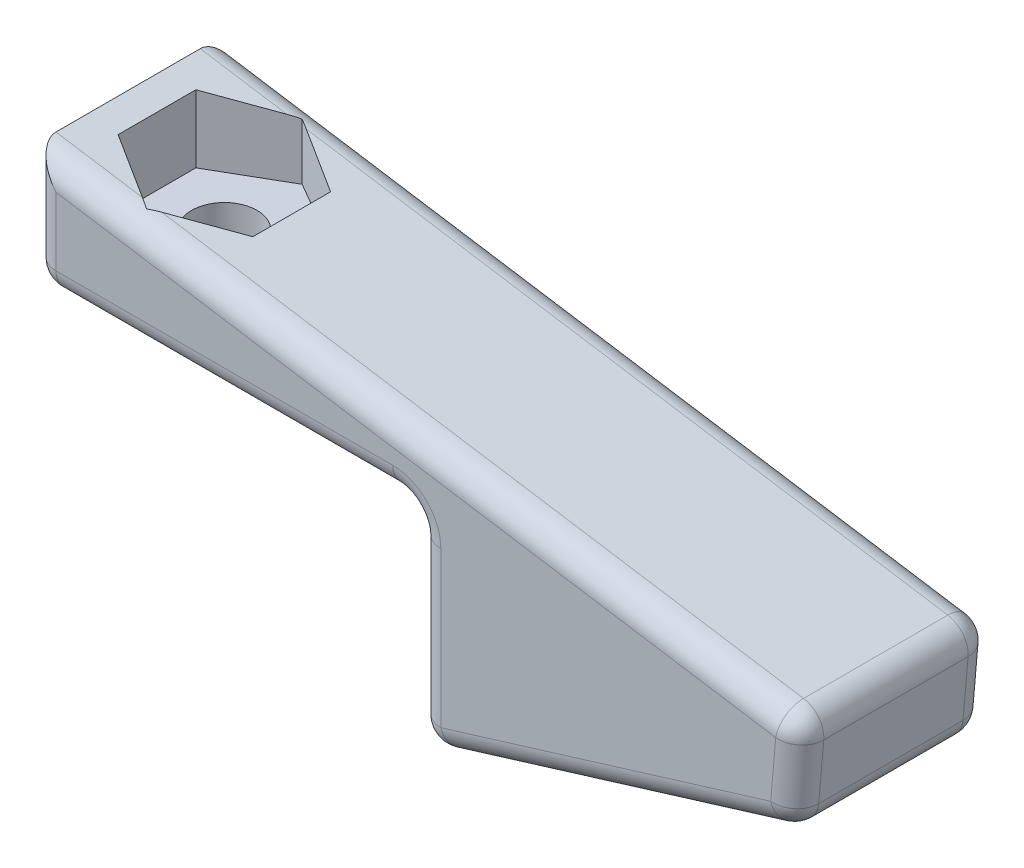
from build123d import *

# Parameters (mm, degrees)
BOSS_EXTRUDE1_DEPTH = 6.35
CUT_EXTRUDE1_REACH  = 55.067
SKETCH2_R           = 2.159
CUT_EXTRUDE2_REACH  = 58.242
CUT_EXTRUDE2_START  = -3.175
SKETCH4_R           = 1.905
CUT_EXTRUDE3_DEPTH  = 19.05
FILLET1_R           = 1.5875


with BuildPart() as part:
    # Sketch1 → Boss-Extrude1 (new, symmetric)
    with BuildSketch(Plane.XY):
        Polygon((0, 0), (0, 7.9375), (25.4, 3.96875), (50.8, 0), (50.244446987, -6.35), (25.4, -13.97), (25.4, 0), align=None)
    extrude(amount=BOSS_EXTRUDE1_DEPTH, both=True)

    # Cut-Extrude1: up to this plane
    cut_extrude1_end = Plane(origin=(0, 7.9375, 6.35), z_dir=(-0.15437688027360963, -0.9880120337511015, 0))
    # Sketch2 → Cut-Extrude1 (cut, up to the surface)
    with BuildSketch(Plane(origin=(0, 0, 0), x_dir=(-1, 0, 0), z_dir=(0, -1, 0)), mode=Mode.PRIVATE) as cut_extrude1_sk1:
        with Locations(Location((-6.35, 0, 0), (0, 0, 180))):
            Circle(SKETCH2_R)
    cut_extrude1_tool1 = split(extrude(cut_extrude1_sk1.sketch, amount=-CUT_EXTRUDE1_REACH, mode=Mode.PRIVATE), bisect_by=cut_extrude1_end, keep=Keep.BOTH, mode=Mode.PRIVATE)
    add(cut_extrude1_tool1.solids().sort_by_distance((6.35, 0, 0))[0], mode=Mode.SUBTRACT)

    # Cut-Extrude2: up to this plane
    cut_extrude2_end = Plane(origin=(0, 7.9375, 6.35), z_dir=(-0.15437688027360963, -0.9880120337511015, 0))
    # Sketch3 → Cut-Extrude2 (cut, up to the surface)
    with BuildSketch(Plane.XZ.offset(CUT_EXTRUDE2_START), mode=Mode.PRIVATE) as cut_extrude2_sk1:
        Polygon((6.35, 5.132643893), (1.905, 2.566321947), (1.905, -2.566321947), (6.35, -5.132643893), (10.795, -2.566321947), (10.795, 2.566321947), align=None)
    cut_extrude2_tool1 = split(extrude(cut_extrude2_sk1.sketch, amount=-CUT_EXTRUDE2_REACH, mode=Mode.PRIVATE), bisect_by=cut_extrude2_end, keep=Keep.BOTH, mode=Mode.PRIVATE)
    add(cut_extrude2_tool1.solids().sort_by_distance((6.35, 3.175, 0))[0], mode=Mode.SUBTRACT)

    # Sketch4 → Cut-Extrude3 (cut)
    with BuildSketch(Plane.ZY.offset(-25.4)):
        with Locations((0, -7.62)):
            Circle(SKETCH4_R)
    extrude(amount=-CUT_EXTRUDE3_DEPTH, mode=Mode.SUBTRACT)

    # Fillet1
    # the kernel refuses this fillet: 1.5875 mm, written as the material it adds along each edge
    with BuildSketch(Plane(origin=(25.4, 0, -6.35), x_dir=(-1, 0, 0), z_dir=(0, 0, 1))) as fillet1_piece_1:
        with BuildLine():
            CenterArc((FILLET1_R, FILLET1_R), FILLET1_R, 180, 90)
            Line((0, FILLET1_R), (0, 0))
            Line((0, 0), (FILLET1_R, 0))
        make_face()
    extrude(amount=12.7)
    # the kernel refuses this fillet: 1.5875 mm, written as the material it takes off along each edge
    with BuildSketch(Plane(origin=(1.5875, 1.5875, -4.7625), x_dir=(0, -1, 0), z_dir=(-1, 0, 0))) as fillet1_2_piece_1_section:
        Polygon((0, 0), (FILLET1_R, 0), (FILLET1_R, -FILLET1_R), (0, -FILLET1_R), align=None)
    fillet1_2_piece_1 = extrude(amount=FILLET1_R, mode=Mode.PRIVATE)
    fillet1_2_piece_1 = fillet1_2_piece_1 - Plane(origin=(1.5875, 1.5875, -4.7625), x_dir=(0, 0.7071067811865475, 0.7071067811865475), z_dir=(-1, 0, 0)) * Sphere(FILLET1_R, mode=Mode.PRIVATE)
    add(fillet1_2_piece_1, mode=Mode.SUBTRACT)
    with BuildSketch(Plane(origin=(1.5875, 1.5875, 4.7625), x_dir=(0, -1, 0), z_dir=(-1, 0, 0))) as fillet1_2_piece_2_section:
        Polygon((0, 0), (FILLET1_R, 0), (FILLET1_R, FILLET1_R), (0, FILLET1_R), align=None)
    fillet1_2_piece_2 = extrude(amount=FILLET1_R, mode=Mode.PRIVATE)
    fillet1_2_piece_2 = fillet1_2_piece_2 - Plane(origin=(1.5875, 1.5875, 4.7625), x_dir=(0, 0.7071067811865475, -0.7071067811865475), z_dir=(-1, 0, 0)) * Sphere(FILLET1_R, mode=Mode.PRIVATE)
    add(fillet1_2_piece_2, mode=Mode.SUBTRACT)
    with BuildSketch(Plane(origin=(48.756222782, -5.145960715, 4.7625), x_dir=(0.9961946980917461, -0.08715574274765191, 0), z_dir=(0, 0, 1))) as fillet1_2_piece_3_section:
        Polygon((0, 0), (FILLET1_R, 0), (FILLET1_R, -FILLET1_R * 0.67385843517), (FILLET1_R * 0.375435230935, -FILLET1_R * 0.926848632395), align=None)
    fillet1_2_piece_3 = extrude(amount=FILLET1_R, mode=Mode.PRIVATE)
    fillet1_2_piece_3 = fillet1_2_piece_3 - Plane(origin=(48.756222782, -5.145960715, 4.7625), x_dir=(-0.7774271509889946, 0.6289729921905509, 0), z_dir=(0, 0, 1)) * Sphere(FILLET1_R, mode=Mode.PRIVATE)
    add(fillet1_2_piece_3, mode=Mode.SUBTRACT)
    with BuildSketch(Plane(origin=(26.9875, -11.822610338, 4.7625), x_dir=(0.2932264055627704, -0.9560430299315705, 0), z_dir=(0, 0, 1))) as fillet1_2_piece_4_section:
        Polygon((0, 0), (FILLET1_R, 0), (FILLET1_R, -FILLET1_R * 1.35268640121), (-FILLET1_R * 0.293226405563, -FILLET1_R * 0.956043029932), align=None)
    fillet1_2_piece_4 = extrude(amount=FILLET1_R, mode=Mode.PRIVATE)
    fillet1_2_piece_4 = fillet1_2_piece_4 - Plane(origin=(26.9875, -11.822610338, 4.7625), x_dir=(0.5944634532236736, 0.8041226291936978, 0), z_dir=(0, 0, 1)) * Sphere(FILLET1_R, mode=Mode.PRIVATE)
    add(fillet1_2_piece_4, mode=Mode.SUBTRACT)
    with BuildSketch(Plane(origin=(49.089248712, -1.339456918, 4.7625), x_dir=(0.9961946980917461, -0.08715574274765191, 0), z_dir=(0, 0, 1))) as fillet1_2_piece_5_section:
        Polygon((0, 0), (FILLET1_R, 0), (FILLET1_R, FILLET1_R * 0.934464049622), (FILLET1_R * 0.0676785069913, FILLET1_R * 0.997707181337), align=None)
    fillet1_2_piece_5 = extrude(amount=FILLET1_R, mode=Mode.PRIVATE)
    fillet1_2_piece_5 = fillet1_2_piece_5 - Plane(origin=(49.089248712, -1.339456918, 4.7625), x_dir=(-0.7873691485833406, -0.6164818114584931, 0), z_dir=(0, 0, 1)) * Sphere(FILLET1_R, mode=Mode.PRIVATE)
    add(fillet1_2_piece_5, mode=Mode.SUBTRACT)
    with BuildSketch(Plane(origin=(49.089248712, -1.339456918, -4.7625), x_dir=(0.15437688027360963, 0.9880120337511015, 0), z_dir=(0, 0, -1))) as fillet1_2_piece_6_section:
        Polygon((0, 0), (FILLET1_R, 0), (FILLET1_R, FILLET1_R * 0.934464049622), (FILLET1_R * 0.0676785069913, FILLET1_R * 0.997707181337), align=None)
    fillet1_2_piece_6 = extrude(amount=FILLET1_R, mode=Mode.PRIVATE)
    fillet1_2_piece_6 = fillet1_2_piece_6 - Plane(origin=(49.089248712, -1.339456918, -4.7625), x_dir=(-0.7873691485833406, -0.6164818114584931, 0), z_dir=(0, 0, -1)) * Sphere(FILLET1_R, mode=Mode.PRIVATE)
    add(fillet1_2_piece_6, mode=Mode.SUBTRACT)
    with BuildSketch(Plane(origin=(48.756222782, -5.145960715, -4.7625), x_dir=(0.9961946980917461, -0.08715574274765191, 0), z_dir=(0, 0, -1))) as fillet1_2_piece_7_section:
        Polygon((0, 0), (FILLET1_R, 0), (FILLET1_R, FILLET1_R * 0.67385843517), (FILLET1_R * 0.375435230935, FILLET1_R * 0.926848632395), align=None)
    fillet1_2_piece_7 = extrude(amount=FILLET1_R, mode=Mode.PRIVATE)
    fillet1_2_piece_7 = fillet1_2_piece_7 - Plane(origin=(48.756222782, -5.145960715, -4.7625), x_dir=(-0.7774271509889946, 0.6289729921905509, 0), z_dir=(0, 0, -1)) * Sphere(FILLET1_R, mode=Mode.PRIVATE)
    add(fillet1_2_piece_7, mode=Mode.SUBTRACT)
    with BuildSketch(Plane(origin=(26.9875, -11.822610338, -4.7625), x_dir=(0.2932264055627704, -0.9560430299315705, 0), z_dir=(0, 0, -1))) as fillet1_2_piece_8_section:
        Polygon((0, 0), (FILLET1_R, 0), (FILLET1_R, FILLET1_R * 1.35268640121), (-FILLET1_R * 0.293226405563, FILLET1_R * 0.956043029932), align=None)
    fillet1_2_piece_8 = extrude(amount=FILLET1_R, mode=Mode.PRIVATE)
    fillet1_2_piece_8 = fillet1_2_piece_8 - Plane(origin=(26.9875, -11.822610338, -4.7625), x_dir=(0.5944634532236736, 0.8041226291936978, 0), z_dir=(0, 0, -1)) * Sphere(FILLET1_R, mode=Mode.PRIVATE)
    add(fillet1_2_piece_8, mode=Mode.SUBTRACT)
    with BuildSketch(Plane(origin=(23.8125, 0, -6.35), x_dir=(0, 0, 1), z_dir=(-1, 0, 0))) as fillet1_2_piece_9:
        with BuildLine():
            CenterArc((FILLET1_R, FILLET1_R), FILLET1_R, 180, 90)
            Line((0, FILLET1_R), (0, 0))
            Line((0, 0), (FILLET1_R, 0))
        make_face()
    extrude(amount=22.225, mode=Mode.SUBTRACT)
    with BuildSketch(Plane(origin=(0, 0, -4.7625), x_dir=(0, 1, 0), z_dir=(0, 0, 1))) as fillet1_2_piece_10:
        with BuildLine():
            CenterArc((FILLET1_R, -FILLET1_R), FILLET1_R, 90, 90)
            Line((0, -FILLET1_R), (0, 0))
            Line((0, 0), (FILLET1_R, 0))
        make_face()
    extrude(amount=9.525, mode=Mode.SUBTRACT)
    with BuildSketch(Plane(origin=(49.221719701, -6.663679025, 6.35), x_dir=(-0.2932264055627704, 0.9560430299315705, 0), z_dir=(-0.9560430299315705, -0.2932264055627704, 0))) as fillet1_2_piece_11:
        with BuildLine():
            CenterArc((FILLET1_R, FILLET1_R), FILLET1_R, 180, 90)
            Line((0, FILLET1_R), (0, 0))
            Line((0, 0), (FILLET1_R, 0))
        make_face()
    extrude(amount=22.769605657, mode=Mode.SUBTRACT)
    with BuildSketch(Plane(origin=(50.8, 0, 4.7625), x_dir=(-0.9880120337511016, 0.15437688027360932, 0), z_dir=(0, 0, -1))) as fillet1_2_piece_12:
        with BuildLine():
            CenterArc((FILLET1_R * 0.934464049622, -FILLET1_R), FILLET1_R, 90, 86.119340849)
            Line((-FILLET1_R * 0.0632431317154, -FILLET1_R * 0.932321493009), (0, 0))
            Line((0, 0), (FILLET1_R * 0.934464049622, 0))
        make_face()
    extrude(amount=9.525, mode=Mode.SUBTRACT)
    with BuildSketch(Plane(origin=(50.244446987, -6.35, 4.7625), x_dir=(0.08715574274764938, 0.9961946980917463, 0), z_dir=(0, 0, -1))) as fillet1_2_piece_13:
        with BuildLine():
            CenterArc((FILLET1_R * 0.67385843517, -FILLET1_R), FILLET1_R, 90, 67.948784684)
            Line((-FILLET1_R * 0.252990197225, -FILLET1_R * 0.624564769065), (0, 0))
            Line((0, 0), (FILLET1_R * 0.67385843517, 0))
        make_face()
    extrude(amount=9.525, mode=Mode.SUBTRACT)
    with BuildSketch(Plane(origin=(25.4, -13.97, -4.7625), x_dir=(0.9560430299315704, 0.2932264055627704, 0), z_dir=(0, 0, 1))) as fillet1_2_piece_14:
        with BuildLine():
            CenterArc((FILLET1_R * 1.35268640121, FILLET1_R), FILLET1_R, 162.948784684, 107.051215316)
            Line((FILLET1_R * 0.396643371281, FILLET1_R * 1.29322640556), (0, 0))
            Line((0, 0), (FILLET1_R * 1.35268640121, 0))
        make_face()
    extrude(amount=9.525, mode=Mode.SUBTRACT)
    with BuildSketch(Plane(origin=(50.670707796, -1.477816659, 6.35), x_dir=(-0.9961946980917462, 0.08715574274765192, 0), z_dir=(-0.08715574274765191, -0.9961946980917461, 0))) as fillet1_2_piece_15:
        with BuildLine():
            CenterArc((FILLET1_R, FILLET1_R), FILLET1_R, 180, 90)
            Line((0, FILLET1_R), (0, 0))
            Line((0, 0), (FILLET1_R, 0))
        make_face()
    extrude(amount=3.821044024, mode=Mode.SUBTRACT)
    with BuildSketch(Plane(origin=(-3.921172759, 8.550183244, 6.35), x_dir=(0, 0, -1), z_dir=(0.9880120337511015, -0.1543768802736096, 0))) as fillet1_2_piece_16:
        with BuildLine():
            CenterArc((FILLET1_R, -FILLET1_R), FILLET1_R, 90, 90)
            Line((0, -FILLET1_R), (0, 0))
            Line((0, 0), (FILLET1_R, 0))
        make_face()
    extrude(amount=53.901666123, mode=Mode.SUBTRACT)
    with BuildSketch(Plane(origin=(0, 1.5875, 6.35), x_dir=(0, 0, -1), z_dir=(0, 1, 0))) as fillet1_2_piece_17:
        with BuildLine():
            CenterArc((FILLET1_R, -FILLET1_R), FILLET1_R, 90, 90)
            Line((0, -FILLET1_R), (0, 0))
            Line((0, 0), (FILLET1_R, 0))
        make_face()
    extrude(amount=10.31875, mode=Mode.SUBTRACT)
    with BuildSketch(Plane(origin=(23.8125, 0, 6.35), x_dir=(0, 0, -1), z_dir=(-1, 0, 0))) as fillet1_2_piece_18:
        with BuildLine():
            CenterArc((FILLET1_R, -FILLET1_R), FILLET1_R, 90, 90)
            Line((0, -FILLET1_R), (0, 0))
            Line((0, 0), (FILLET1_R, 0))
        make_face()
    extrude(amount=22.225, mode=Mode.SUBTRACT)
    with BuildSketch(Plane(origin=(0, 1.5875, -6.35), x_dir=(0, 0, 1), z_dir=(0, 1, 0))) as fillet1_2_piece_19:
        with BuildLine():
            CenterArc((FILLET1_R, FILLET1_R), FILLET1_R, 180, 90)
            Line((0, FILLET1_R), (0, 0))
            Line((0, 0), (FILLET1_R, 0))
        make_face()
    extrude(amount=10.31875, mode=Mode.SUBTRACT)
    with BuildSketch(Plane(origin=(49.33432201, 0.229012186, -6.35), x_dir=(-0.1543768802736096, -0.9880120337511015, 0), z_dir=(-0.9880120337511015, 0.1543768802736096, 0))) as fillet1_2_piece_20:
        with BuildLine():
            CenterArc((FILLET1_R, FILLET1_R), FILLET1_R, 180, 90)
            Line((0, FILLET1_R), (0, 0))
            Line((0, 0), (FILLET1_R, 0))
        make_face()
    extrude(amount=53.901666123, mode=Mode.SUBTRACT)
    with BuildSketch(Plane(origin=(50.670707796, -1.477816659, -6.35), x_dir=(-0.9961946980917462, 0.08715574274765192, 0), z_dir=(-0.08715574274765191, -0.9961946980917461, 0))) as fillet1_2_piece_21:
        with BuildLine():
            CenterArc((FILLET1_R, -FILLET1_R), FILLET1_R, 90, 90)
            Line((0, -FILLET1_R), (0, 0))
            Line((0, 0), (FILLET1_R, 0))
        make_face()
    extrude(amount=3.821044024, mode=Mode.SUBTRACT)
    with BuildSketch(Plane(origin=(25.4, -11.822610338, 6.35), x_dir=(1, 0, 0), z_dir=(0, 1, 0))) as fillet1_2_piece_22:
        with BuildLine():
            CenterArc((FILLET1_R, FILLET1_R), FILLET1_R, 180, 90)
            Line((0, FILLET1_R), (0, 0))
            Line((0, 0), (FILLET1_R, 0))
        make_face()
    extrude(amount=10.235110338, mode=Mode.SUBTRACT)
    with BuildSketch(Plane(origin=(49.221719701, -6.663679025, -6.35), x_dir=(-0.2932264055627704, 0.9560430299315705, 0), z_dir=(-0.9560430299315705, -0.2932264055627704, 0))) as fillet1_2_piece_23:
        with BuildLine():
            CenterArc((FILLET1_R, -FILLET1_R), FILLET1_R, 90, 90)
            Line((0, -FILLET1_R), (0, 0))
            Line((0, 0), (FILLET1_R, 0))
        make_face()
    extrude(amount=22.769605657, mode=Mode.SUBTRACT)
    with BuildSketch(Plane(origin=(25.4, -11.822610338, -6.35), x_dir=(1, 0, 0), z_dir=(0, 1, 0))) as fillet1_2_piece_24:
        with BuildLine():
            CenterArc((FILLET1_R, -FILLET1_R), FILLET1_R, 90, 90)
            Line((0, -FILLET1_R), (0, 0))
            Line((0, 0), (FILLET1_R, 0))
        make_face()
    extrude(amount=10.235110338, mode=Mode.SUBTRACT)
    with BuildSketch(Plane(origin=(23.8125, -1.5875, -6.35), x_dir=(0, 1, 0), z_dir=(-1, 0, 0))) as fillet1_2_piece_25:
        with BuildLine():
            CenterArc((1.5875 + FILLET1_R, -FILLET1_R), FILLET1_R, 90, 90)
            Line((1.5875, -FILLET1_R), (1.5875, 0))
            Line((1.5875, 0), (1.5875 + FILLET1_R, 0))
        make_face()
    revolve(axis=Axis((23.8125, -1.5875, -6.35), (0, 0, -1)), revolution_arc=90, mode=Mode.SUBTRACT)
    with BuildSketch(Plane(origin=(23.8125, -1.5875, 6.35), x_dir=(0, 1, 0), z_dir=(-1, 0, 0))) as fillet1_2_piece_26:
        with BuildLine():
            CenterArc((1.5875 + FILLET1_R, FILLET1_R), FILLET1_R, 180, 90)
            Line((1.5875, FILLET1_R), (1.5875, 0))
            Line((1.5875, 0), (1.5875 + FILLET1_R, 0))
        make_face()
    revolve(axis=Axis((23.8125, -1.5875, 6.35), (0, 0, -1)), revolution_arc=90, mode=Mode.SUBTRACT)


solid = part.part
